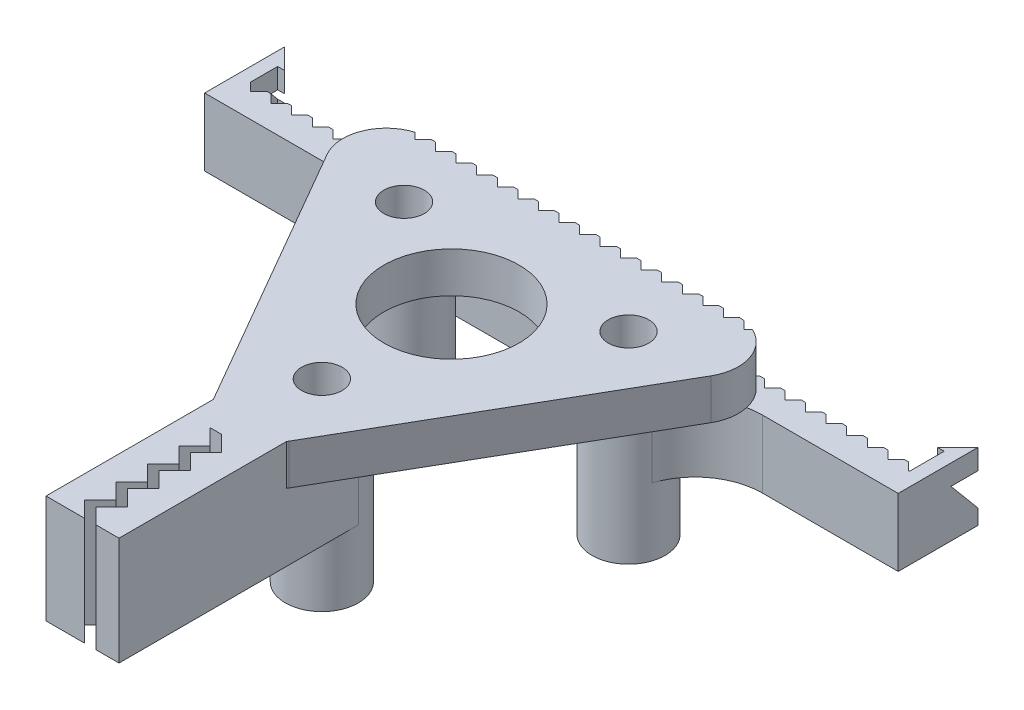
from build123d import *
from build123d.topology import SkipClean

# Parameters (mm, degrees)
SKETCH1_R                = 1.5
CASTER_BASE_DEPTH        = 3
SKETCH2_R                = 2.7
SKETCH2_R_2              = 1.6
CASTER_STANDOFFS_DEPTH   = 10
CUT_EXTRUDE4_REACH       = 35.803
SKETCH7_R                = 5
BOSS_EXTRUDE3_DEPTH      = 25
BOSS_EXTRUDE3_DEPTH_BACK = 25
BOSS_EXTRUDE3_START      = 8.65656565
SKETCH9_W                = 2.4
SKETCH9_H                = 5
CUT_EXTRUDE5_REACH       = 42.561
LPATTERN1_COUNT          = 33
LPATTERN1_PITCH          = 1.52
BOSS_EXTRUDE4_DEPTH      = 5
BOSS_EXTRUDE5_DEPTH      = 15
BOSS_EXTRUDE5_DEPTH_BACK = 2.7
SKETCH12_W               = 5.4
SKETCH12_H               = 8
FILLET1_R                = 5
SKETCH13_R               = 1.5
CUT_EXTRUDE6_DEPTH       = 49.477086379
CUT_EXTRUDE7_DEPTH       = 62.312429974


with BuildPart() as part:
    # Sketch1 → Caster Base (new body)
    with BuildSketch(Plane(origin=(0, 0, 0), x_dir=(1, 0, 0), z_dir=(0, 1, 0))):
        with BuildLine():
            Line((-3.117691454, 5), (19.717691454, 5))
            ThreePointArc((19.717691454, 5), (22.488972746, 3.4), (22.488972746, 0.2))
            Line((22.488972746, 0.2), (11.071281292, -19.576021703))
            ThreePointArc((11.071281292, -19.576021703), (8.3, -21.176021703), (5.528718708, -19.576021703))
            Line((5.528718708, -19.576021703), (-5.888972746, 0.2))
            ThreePointArc((-5.888972746, 0.2), (-5.888972746, 3.4), (-3.117691454, 5))
        make_face()
        with Locations(Location((0, 0, 0), (0, 0, 270))):
            Circle(SKETCH1_R, mode=Mode.SUBTRACT)
        with Locations(Location((16.6, 0, 0), (0, 0, 270))):
            Circle(SKETCH1_R, mode=Mode.SUBTRACT)
        with Locations(Location((8.3, -14.376021703, 0), (0, 0, 270))):
            Circle(SKETCH1_R, mode=Mode.SUBTRACT)
    extrude(amount=CASTER_BASE_DEPTH)

    # Sketch2 → Caster Standoffs (add)
    # profile 1 of 3: a face of its own
    with BuildSketch(Plane.XZ):
        with Locations(Location((8.3, 14.376021703, 0), (0, 0, 270))):
            Circle(SKETCH2_R)
        with Locations(Location((8.3, 14.376021703, 0), (0, 0, 270))):
            Circle(SKETCH2_R_2, mode=Mode.SUBTRACT)
    # profile 2 of 3: a face of its own
    with BuildSketch(Plane.XZ):
        with Locations(Location((0, 0, 0), (0, 0, 270))):
            Circle(SKETCH2_R)
        with Locations(Location((0, 0, 0), (0, 0, 270))):
            Circle(SKETCH2_R_2, mode=Mode.SUBTRACT)
    # profile 3 of 3: a face of its own
    with BuildSketch(Plane.XZ):
        with Locations(Location((16.6, 0, 0), (0, 0, 270))):
            Circle(SKETCH2_R)
        with Locations(Location((16.6, 0, 0), (0, 0, 270))):
            Circle(SKETCH2_R_2, mode=Mode.SUBTRACT)
    extrude(amount=CASTER_STANDOFFS_DEPTH)

    # Sketch7 → Cut-Extrude4 (cut, up to next)
    with BuildSketch(Plane(origin=(0, 3, 0), x_dir=(1, 0, 0), z_dir=(0, 1, 0)), mode=Mode.PRIVATE) as cut_extrude4_sk1:
        with Locations(Location((8.3, -4.792007234, 0), (0, 0, 270))):
            Circle(SKETCH7_R)
    cut_extrude4_tool1 = extrude(cut_extrude4_sk1.sketch, amount=-CUT_EXTRUDE4_REACH, mode=Mode.PRIVATE) & part.part
    add(cut_extrude4_tool1.solids().sort_by_distance((8.3, 3, 4.792007))[0], mode=Mode.SUBTRACT)

    # Sketch9 → Boss-Extrude3 (add, two sides: drawn at the far end of the back side and taken through both)
    with BuildSketch(Plane(origin=(0, 0, 0), x_dir=(0, 0, -1), z_dir=(1, 0, 0)).offset(BOSS_EXTRUDE3_START - BOSS_EXTRUDE3_DEPTH_BACK)):
        with Locations((3.8, -2.5)):
            Rectangle(SKETCH9_W, SKETCH9_H)
    extrude(amount=BOSS_EXTRUDE3_DEPTH + BOSS_EXTRUDE3_DEPTH_BACK)

    # Sketch10 → Cut-Extrude5 (cut, up to next)
    with BuildSketch(Plane.XZ.offset(5), mode=Mode.PRIVATE) as cut_extrude5_sk1:
        Polygon((-16.34343435, -5), (-15.74343435, -4.4), (-15.14343435, -5), align=None)
    cut_extrude5_tool1 = extrude(cut_extrude5_sk1.sketch, amount=-CUT_EXTRUDE5_REACH, mode=Mode.PRIVATE) & part.part
    cut_extrude5 = cut_extrude5_tool1.solids().sort_by_distance((-15.743434, -5, -4.8))[0]
    add(cut_extrude5, mode=Mode.SUBTRACT)

    # LPattern1: Cut-Extrude5; each copy of Cut-Extrude5 runs up to whatever stops it at its own place
    lpattern1_before = part.part  # the part as the pattern finds it: every copy runs up to it
    lpattern1_cut_extrude5_long = extrude(cut_extrude5_sk1.sketch, amount=-CUT_EXTRUDE5_REACH, mode=Mode.PRIVATE)
    lpattern1_cut_extrude5_tool1 = lpattern1_cut_extrude5_long.moved(Location(Vector(1, 0, 0) * (1 * LPATTERN1_PITCH))) & lpattern1_before
    add(lpattern1_cut_extrude5_tool1.solids().sort_by_distance((-14.223434, -5, -4.8))[0], mode=Mode.SUBTRACT)
    lpattern1_cut_extrude5_tool2 = lpattern1_cut_extrude5_long.moved(Location(Vector(1, 0, 0) * (2 * LPATTERN1_PITCH))) & lpattern1_before
    add(lpattern1_cut_extrude5_tool2.solids().sort_by_distance((-12.703434, -5, -4.8))[0], mode=Mode.SUBTRACT)
    lpattern1_cut_extrude5_tool3 = lpattern1_cut_extrude5_long.moved(Location(Vector(1, 0, 0) * (3 * LPATTERN1_PITCH))) & lpattern1_before
    add(lpattern1_cut_extrude5_tool3.solids().sort_by_distance((-11.183434, -5, -4.8))[0], mode=Mode.SUBTRACT)
    lpattern1_cut_extrude5_tool4 = lpattern1_cut_extrude5_long.moved(Location(Vector(1, 0, 0) * (4 * LPATTERN1_PITCH))) & lpattern1_before
    add(lpattern1_cut_extrude5_tool4.solids().sort_by_distance((-9.663434, -5, -4.8))[0], mode=Mode.SUBTRACT)
    lpattern1_cut_extrude5_tool5 = lpattern1_cut_extrude5_long.moved(Location(Vector(1, 0, 0) * (5 * LPATTERN1_PITCH))) & lpattern1_before
    add(lpattern1_cut_extrude5_tool5.solids().sort_by_distance((-8.143434, -5, -4.8))[0], mode=Mode.SUBTRACT)
    lpattern1_cut_extrude5_tool6 = lpattern1_cut_extrude5_long.moved(Location(Vector(1, 0, 0) * (6 * LPATTERN1_PITCH))) & lpattern1_before
    add(lpattern1_cut_extrude5_tool6.solids().sort_by_distance((-6.623434, -5, -4.8))[0], mode=Mode.SUBTRACT)
    lpattern1_cut_extrude5_tool7 = lpattern1_cut_extrude5_long.moved(Location(Vector(1, 0, 0) * (7 * LPATTERN1_PITCH))) & lpattern1_before
    add(lpattern1_cut_extrude5_tool7.solids().sort_by_distance((-5.103434, -5, -4.8))[0], mode=Mode.SUBTRACT)
    lpattern1_cut_extrude5_tool8 = lpattern1_cut_extrude5_long.moved(Location(Vector(1, 0, 0) * (8 * LPATTERN1_PITCH))) & lpattern1_before
    add(lpattern1_cut_extrude5_tool8.solids().sort_by_distance((-3.583434, -5, -4.8))[0], mode=Mode.SUBTRACT)
    lpattern1_cut_extrude5_tool9 = lpattern1_cut_extrude5_long.moved(Location(Vector(1, 0, 0) * (9 * LPATTERN1_PITCH))) & lpattern1_before
    add(lpattern1_cut_extrude5_tool9.solids().sort_by_distance((-2.063434, -5, -4.8))[0], mode=Mode.SUBTRACT)
    lpattern1_cut_extrude5_tool10 = lpattern1_cut_extrude5_long.moved(Location(Vector(1, 0, 0) * (10 * LPATTERN1_PITCH))) & lpattern1_before
    add(lpattern1_cut_extrude5_tool10.solids().sort_by_distance((-0.543434, -5, -4.8))[0], mode=Mode.SUBTRACT)
    lpattern1_cut_extrude5_tool11 = lpattern1_cut_extrude5_long.moved(Location(Vector(1, 0, 0) * (11 * LPATTERN1_PITCH))) & lpattern1_before
    add(lpattern1_cut_extrude5_tool11.solids().sort_by_distance((0.976566, -5, -4.8))[0], mode=Mode.SUBTRACT)
    lpattern1_cut_extrude5_tool12 = lpattern1_cut_extrude5_long.moved(Location(Vector(1, 0, 0) * (12 * LPATTERN1_PITCH))) & lpattern1_before
    add(lpattern1_cut_extrude5_tool12.solids().sort_by_distance((2.496566, -5, -4.8))[0], mode=Mode.SUBTRACT)
    lpattern1_cut_extrude5_tool13 = lpattern1_cut_extrude5_long.moved(Location(Vector(1, 0, 0) * (13 * LPATTERN1_PITCH))) & lpattern1_before
    add(lpattern1_cut_extrude5_tool13.solids().sort_by_distance((4.016566, -5, -4.8))[0], mode=Mode.SUBTRACT)
    lpattern1_cut_extrude5_tool14 = lpattern1_cut_extrude5_long.moved(Location(Vector(1, 0, 0) * (14 * LPATTERN1_PITCH))) & lpattern1_before
    add(lpattern1_cut_extrude5_tool14.solids().sort_by_distance((5.536566, -5, -4.8))[0], mode=Mode.SUBTRACT)
    lpattern1_cut_extrude5_tool15 = lpattern1_cut_extrude5_long.moved(Location(Vector(1, 0, 0) * (15 * LPATTERN1_PITCH))) & lpattern1_before
    add(lpattern1_cut_extrude5_tool15.solids().sort_by_distance((7.056566, -5, -4.8))[0], mode=Mode.SUBTRACT)
    lpattern1_cut_extrude5_tool16 = lpattern1_cut_extrude5_long.moved(Location(Vector(1, 0, 0) * (16 * LPATTERN1_PITCH))) & lpattern1_before
    add(lpattern1_cut_extrude5_tool16.solids().sort_by_distance((8.576566, -5, -4.8))[0], mode=Mode.SUBTRACT)
    lpattern1_cut_extrude5_tool17 = lpattern1_cut_extrude5_long.moved(Location(Vector(1, 0, 0) * (17 * LPATTERN1_PITCH))) & lpattern1_before
    add(lpattern1_cut_extrude5_tool17.solids().sort_by_distance((10.096566, -5, -4.8))[0], mode=Mode.SUBTRACT)
    lpattern1_cut_extrude5_tool18 = lpattern1_cut_extrude5_long.moved(Location(Vector(1, 0, 0) * (18 * LPATTERN1_PITCH))) & lpattern1_before
    add(lpattern1_cut_extrude5_tool18.solids().sort_by_distance((11.616566, -5, -4.8))[0], mode=Mode.SUBTRACT)
    lpattern1_cut_extrude5_tool19 = lpattern1_cut_extrude5_long.moved(Location(Vector(1, 0, 0) * (19 * LPATTERN1_PITCH))) & lpattern1_before
    add(lpattern1_cut_extrude5_tool19.solids().sort_by_distance((13.136566, -5, -4.8))[0], mode=Mode.SUBTRACT)
    lpattern1_cut_extrude5_tool20 = lpattern1_cut_extrude5_long.moved(Location(Vector(1, 0, 0) * (20 * LPATTERN1_PITCH))) & lpattern1_before
    add(lpattern1_cut_extrude5_tool20.solids().sort_by_distance((14.656566, -5, -4.8))[0], mode=Mode.SUBTRACT)
    lpattern1_cut_extrude5_tool21 = lpattern1_cut_extrude5_long.moved(Location(Vector(1, 0, 0) * (21 * LPATTERN1_PITCH))) & lpattern1_before
    add(lpattern1_cut_extrude5_tool21.solids().sort_by_distance((16.176566, -5, -4.8))[0], mode=Mode.SUBTRACT)
    lpattern1_cut_extrude5_tool22 = lpattern1_cut_extrude5_long.moved(Location(Vector(1, 0, 0) * (22 * LPATTERN1_PITCH))) & lpattern1_before
    add(lpattern1_cut_extrude5_tool22.solids().sort_by_distance((17.696566, -5, -4.8))[0], mode=Mode.SUBTRACT)
    lpattern1_cut_extrude5_tool23 = lpattern1_cut_extrude5_long.moved(Location(Vector(1, 0, 0) * (23 * LPATTERN1_PITCH))) & lpattern1_before
    add(lpattern1_cut_extrude5_tool23.solids().sort_by_distance((19.216566, -5, -4.8))[0], mode=Mode.SUBTRACT)
    lpattern1_cut_extrude5_tool24 = lpattern1_cut_extrude5_long.moved(Location(Vector(1, 0, 0) * (24 * LPATTERN1_PITCH))) & lpattern1_before
    add(lpattern1_cut_extrude5_tool24.solids().sort_by_distance((20.736566, -5, -4.8))[0], mode=Mode.SUBTRACT)
    lpattern1_cut_extrude5_tool25 = lpattern1_cut_extrude5_long.moved(Location(Vector(1, 0, 0) * (25 * LPATTERN1_PITCH))) & lpattern1_before
    add(lpattern1_cut_extrude5_tool25.solids().sort_by_distance((22.256566, -5, -4.8))[0], mode=Mode.SUBTRACT)
    lpattern1_cut_extrude5_tool26 = lpattern1_cut_extrude5_long.moved(Location(Vector(1, 0, 0) * (26 * LPATTERN1_PITCH))) & lpattern1_before
    add(lpattern1_cut_extrude5_tool26.solids().sort_by_distance((23.776566, -5, -4.8))[0], mode=Mode.SUBTRACT)
    lpattern1_cut_extrude5_tool27 = lpattern1_cut_extrude5_long.moved(Location(Vector(1, 0, 0) * (27 * LPATTERN1_PITCH))) & lpattern1_before
    add(lpattern1_cut_extrude5_tool27.solids().sort_by_distance((25.296566, -5, -4.8))[0], mode=Mode.SUBTRACT)
    lpattern1_cut_extrude5_tool28 = lpattern1_cut_extrude5_long.moved(Location(Vector(1, 0, 0) * (28 * LPATTERN1_PITCH))) & lpattern1_before
    add(lpattern1_cut_extrude5_tool28.solids().sort_by_distance((26.816566, -5, -4.8))[0], mode=Mode.SUBTRACT)
    lpattern1_cut_extrude5_tool29 = lpattern1_cut_extrude5_long.moved(Location(Vector(1, 0, 0) * (29 * LPATTERN1_PITCH))) & lpattern1_before
    add(lpattern1_cut_extrude5_tool29.solids().sort_by_distance((28.336566, -5, -4.8))[0], mode=Mode.SUBTRACT)
    lpattern1_cut_extrude5_tool30 = lpattern1_cut_extrude5_long.moved(Location(Vector(1, 0, 0) * (30 * LPATTERN1_PITCH))) & lpattern1_before
    add(lpattern1_cut_extrude5_tool30.solids().sort_by_distance((29.856566, -5, -4.8))[0], mode=Mode.SUBTRACT)
    lpattern1_cut_extrude5_tool31 = lpattern1_cut_extrude5_long.moved(Location(Vector(1, 0, 0) * (31 * LPATTERN1_PITCH))) & lpattern1_before
    add(lpattern1_cut_extrude5_tool31.solids().sort_by_distance((31.376566, -5, -4.8))[0], mode=Mode.SUBTRACT)
    lpattern1_cut_extrude5_tool32 = lpattern1_cut_extrude5_long.moved(Location(Vector(1, 0, 0) * (32 * LPATTERN1_PITCH))) & lpattern1_before
    add(lpattern1_cut_extrude5_tool32.solids().sort_by_distance((32.896566, -5, -4.8))[0], mode=Mode.SUBTRACT)

    # Sketch11 → Boss-Extrude4 (add)
    with BuildSketch(Plane.XZ.offset(5)):
        Polygon((-16.34343435, -2.6), (-17.34343435, -2.6), (-17.34343435, -8.5), (-15.84343435, -7), (-16.34343435, -7), (-16.34343435, -5), align=None)
        Polygon((32.94343435, -2.6), (32.94343435, -5), (32.94343435, -7), (32.44343435, -7), (33.94343435, -8.5), (33.94343435, -2.6), align=None)
    extrude(amount=-BOSS_EXTRUDE4_DEPTH)

    # Sketch12 → Boss-Extrude5 (add, two sides: drawn at the far end of the back side and taken through both)
    with BuildSketch(Plane.XY.offset(17.076021703).offset(-BOSS_EXTRUDE5_DEPTH_BACK)):
        with Locations((8.3, -1)):
            Rectangle(SKETCH12_W, SKETCH12_H)
    extrude(amount=BOSS_EXTRUDE5_DEPTH + BOSS_EXTRUDE5_DEPTH_BACK)

    # Fillet1
    # the kernel refuses this fillet: 5 mm, written as the material it adds along each edge
    with BuildSketch(Plane(origin=(17.328010989, -5, -2.6), x_dir=(1, 0, 0), z_dir=(0, 1, 0))) as fillet1_piece_1:
        with BuildLine():
            CenterArc((6.588408901, -5), FILLET1_R, 90, 71.838994516)
            ThreePointArc((1.837486894, -3.441558442), (1.65377013, -1.328340179), (0, 0))
            Line((0, 0), (6.588408901, 0))
        make_face()
    extrude(amount=5)

    # Sketch13 → Cut-Extrude6 (cut, through all)
    with SkipClean():  # the faces are left unmerged after this step: merging them gives an invalid solid
        with BuildSketch(Plane(origin=(0, 3, 0), x_dir=(1, 0, 0), z_dir=(0, 1, 0))):
            Polygon((7.3, -30.915803295), (8.460218408, -32.076021703), (9.308746545, -32.076021703), (8.884482477, -31.651757634), (8.148528137, -30.915803295), (9.308746545, -29.755584887), (8.148528137, -28.595366479), (9.308746545, -27.435148071), (8.148528137, -26.274929663), (9.308746545, -25.114711255), (8.148528137, -23.954492847), (9.308746545, -22.79427444), (8.148528137, -21.634056032), (7.3, -21.634056032), (8.460218408, -22.79427444), (7.3, -23.954492847), (8.460218408, -25.114711255), (7.3, -26.274929663), (8.460218408, -27.435148071), (7.3, -28.595366479), (8.460218408, -29.755584887), align=None)
            with Locations(Location((8.3, -14.376021703, 0), (0, 0, 180))):
                Circle(SKETCH13_R)
        extrude(amount=-CUT_EXTRUDE6_DEPTH, mode=Mode.SUBTRACT)

    # Sketch14 → Cut-Extrude7 (cut, through all)
    with SkipClean():  # the faces are left unmerged after this step: merging them gives an invalid solid
        with BuildSketch(Plane.ZY.offset(17.34343435)):
            Polygon((-8.5, -1.5), (-6.5, -1.5), (-8.5, -3.883507185), align=None)
        extrude(amount=-CUT_EXTRUDE7_DEPTH, mode=Mode.SUBTRACT)


solid = part.part
